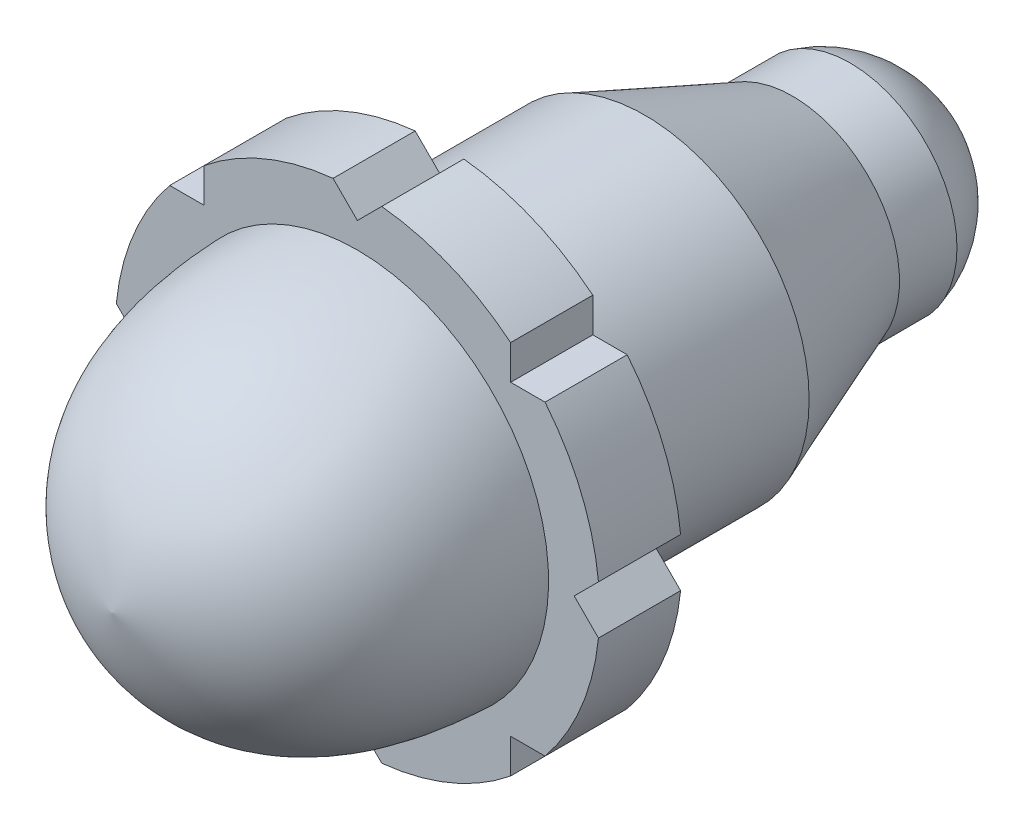
from build123d import *

# Parameters (mm, degrees)
DOME1_FACE_RADIUS  = 3.302
DOME1_HEIGHT       = 2.54
CUT_EXTRUDE1_DEPTH = 21.698272826
SEED_CUT_COUNT     = 8


# Read off the part's stored shape, not the designer's step: Cut-Revolve-Thin1
with BuildPart() as part:
    # Sketch1 → Revolve1 (revolve)
    with BuildSketch(Plane(origin=(0, 0, 0), x_dir=(0, 0, -1), z_dir=(1, 0, 0)), mode=Mode.PRIVATE) as revolve1_sk:
        Polygon((0, 0), (0, 7.493), (2.54, 7.493), (2.54, 5.08), (15.24, 5.08), (15.24, 0), align=None)
    revolve(revolve1_sk.sketch.rotate(Axis((0, 0, 12.712464269), (0, 0, -1)), 90), axis=Axis((0, 0, 12.712464269), (0, 0, -1)))

    # Sketch2 → Revolve2 (revolve)
    with BuildSketch(Plane(origin=(0, 0, 0), x_dir=(0, 0, -1), z_dir=(1, 0, 0))):
        with BuildLine():
            Line((0, 0), (-7.597075699, 0))
            add(Edge.make_bspline(
                [(0, 5.913009527), (-6.698434988, 5.682543743), (-7.597075699, 0)],
                knots=[0, 0, 0, 1, 1, 1], degree=2))
            Line((0, 5.913009527), (0, 0))
        make_face()
    revolve(axis=Axis((0, 0, 12.712464269), (0, 0, 1)))

    # Cut-Revolve-Thin1 outline → Cut-Revolve-Thin1 (revolve, cut)
    with BuildSketch(Plane.XZ):
        Polygon((5.08, -8.89), (3.302, -13.462), (3.302, -15.24), (5.08, -15.24), align=None)
    revolve(axis=Axis((0, 0, 0), (0, 0, 1)), mode=Mode.SUBTRACT)

    # Dome1: a dome of height H over a round flat face of radius A is a cap of a sphere of radius (A * A + H * H) / (2 * H)
    dome1_r = (DOME1_FACE_RADIUS * DOME1_FACE_RADIUS + DOME1_HEIGHT * DOME1_HEIGHT) / (2 * DOME1_HEIGHT)
    dome1_base = Plane((0, 0, -15.24), z_dir=(0, 0, -1))
    with Locations(dome1_base.offset(DOME1_HEIGHT - dome1_r)):
        dome1_ball = Sphere(dome1_r, mode=Mode.PRIVATE)
    add(split(dome1_ball, bisect_by=dome1_base, keep=Keep.TOP, mode=Mode.PRIVATE))

    # Sketch4 → Cut-Extrude1 (cut, through all)
    with BuildSketch(Plane.XY):
        with BuildLine():
            Line((0, 6.703004763), (0.752149198, 7.455153961))
            ThreePointArc((0.752149198, 7.455153961), (0, 7.493), (-0.752149198, 7.455153961))
            Line((-0.752149198, 7.455153961), (0, 6.703004763))
        make_face()
    cut_extrude1 = extrude(amount=-CUT_EXTRUDE1_DEPTH, mode=Mode.SUBTRACT)

    # Seed Cut: Cut-Extrude1 ×8 about axis
    seed_cut_axis = Axis((0, 0, 0), (0, 0, 1))
    for i in range(1, SEED_CUT_COUNT):
        add(cut_extrude1.rotate(seed_cut_axis, i * 360 / SEED_CUT_COUNT), mode=Mode.SUBTRACT)


solid = part.part
